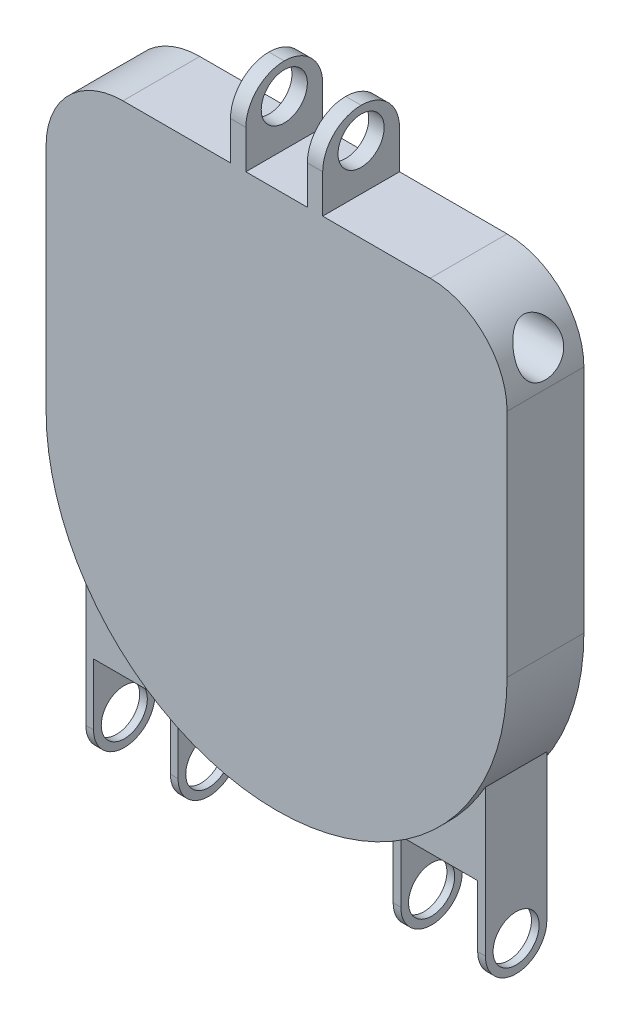
from build123d import *

# Parameters (mm, degrees)
SKETCH1_W                = 30
SKETCH1_H                = 5
BOSS_EXTRUDE1_DEPTH      = 35
FILLET1_R                = 15
FILLET3_R                = 5
SKETCH4_R                = 1.5
CUT_EXTRUDE1_DEPTH       = 35
SKETCH5_W                = 6
SKETCH5_H                = 5
SKETCH5_W_2              = 4
SKETCH5_H_2              = 3
BOSS_EXTRUDE2_DEPTH      = 5
CUT_EXTRUDE2_DEPTH       = 5
SKETCH7_R                = 1.5
CUT_EXTRUDE3_DEPTH       = 15
FILLET4_R                = 2.5
BOSS_EXTRUDE3_DEPTH      = 8
BOSS_EXTRUDE3_DEPTH_BACK = 4
SKETCH8_W                = 6
SKETCH8_H                = 4
SKETCH8_W_2              = 5
SKETCH8_H_2              = 3
SKETCH9_W                = 5
SKETCH9_H                = 4.517478875
CUT_EXTRUDE4_DEPTH       = 6
SKETCH10_R               = 1.5
CUT_EXTRUDE5_DEPTH       = 36
FILLET5_R                = 2
FILLET6_R                = 2


with BuildPart() as part:
    # Sketch1 → Boss-Extrude1 (new body)
    with BuildSketch(Plane(origin=(0, 0, 0), x_dir=(1, 0, 0), z_dir=(0, 1, 0))):
        Rectangle(SKETCH1_W, SKETCH1_H)
    extrude(amount=BOSS_EXTRUDE1_DEPTH)

    # Fillet1
    fillet1_edges = [part.edges().sort_by_distance(p)[0] for p in [
        (15, 0, 0),
        (-15, 0, 0),
    ]]
    fillet(fillet1_edges, radius=FILLET1_R - 0.0001)  # a hair under: the kernel refuses the full size

    # Fillet3
    fillet3_edges = [part.edges().sort_by_distance(p)[0] for p in [
        (15, 35, 0),
        (-15, 35, 0),
    ]]
    fillet(fillet3_edges, radius=FILLET3_R)

    # Sketch4 → Cut-Extrude1 (cut)
    with BuildSketch(Plane.ZY.offset(15)):
        with Locations((0, 32)):
            Circle(SKETCH4_R)
    extrude(amount=-CUT_EXTRUDE1_DEPTH, mode=Mode.SUBTRACT)

    # Sketch5 → Boss-Extrude2 (add)
    with BuildSketch(Plane(origin=(0, 35, 0), x_dir=(1, 0, 0), z_dir=(0, 1, 0))):
        Rectangle(SKETCH5_W, SKETCH5_H)
        Rectangle(SKETCH5_W_2, SKETCH5_H_2, mode=Mode.SUBTRACT)
    extrude(amount=BOSS_EXTRUDE2_DEPTH)

    # Sketch6 → Cut-Extrude2 (cut)
    with BuildSketch(Plane(origin=(0, 40, 0), x_dir=(1, 0, 0), z_dir=(0, 1, 0))):
        Polygon((-2, 1.5), (-2, 3.860545562), (2, 3.860545562), (2, -3.417925007), (-2, -3.417925007), align=None)
    extrude(amount=-CUT_EXTRUDE2_DEPTH, mode=Mode.SUBTRACT)

    # Sketch7 → Cut-Extrude3 (cut)
    with BuildSketch(Plane.ZY.offset(3)):
        with Locations((0, 38)):
            Circle(SKETCH7_R)
    extrude(amount=-CUT_EXTRUDE3_DEPTH, mode=Mode.SUBTRACT)

    # Fillet4
    fillet4_edges = [part.edges().sort_by_distance(p)[0] for p in [
        (-2.5, 40, 2.5),
        (-2.5, 40, -2.5),
        (2.5, 40, 2.5),
        (2.5, 40, -2.5),
    ]]
    fillet(fillet4_edges, radius=FILLET4_R - 0.0001)  # a hair under: the kernel refuses the full size

    # Sketch8 → Boss-Extrude3 (add, two sides: drawn at the far end of the back side and taken through both)
    # profile 1 of 2: a face of its own
    with BuildSketch(Plane(origin=(0, 0, 0), x_dir=(1, 0, 0), z_dir=(0, 1, 0)).offset(-BOSS_EXTRUDE3_DEPTH_BACK)):
        with Locations((-10, 0.087771821)):
            Rectangle(SKETCH8_W, SKETCH8_H)
        with Locations((-10, 0.087771821)):
            Rectangle(SKETCH8_W_2, SKETCH8_H_2, mode=Mode.SUBTRACT)
    # profile 2 of 2: a face of its own
    with BuildSketch(Plane(origin=(0, 0, 0), x_dir=(1, 0, 0), z_dir=(0, 1, 0)).offset(-BOSS_EXTRUDE3_DEPTH_BACK)):
        with Locations((10, 0.087771821)):
            Rectangle(SKETCH8_W, SKETCH8_H)
        with Locations((10, 0.087771821)):
            Rectangle(SKETCH8_W_2, SKETCH8_H_2, mode=Mode.SUBTRACT)
    extrude(amount=BOSS_EXTRUDE3_DEPTH + BOSS_EXTRUDE3_DEPTH_BACK)

    # Sketch9 → Cut-Extrude4 (cut)
    with BuildSketch(Plane.XZ.offset(4)):
        with Locations((-10, -0.111234663)):
            Rectangle(SKETCH9_W, SKETCH9_H)
        with Locations((10, -0.111234663)):
            Rectangle(SKETCH9_W, SKETCH9_H)
    extrude(amount=-CUT_EXTRUDE4_DEPTH, mode=Mode.SUBTRACT)

    # Sketch10 → Cut-Extrude5 (cut)
    with BuildSketch(Plane.ZY.offset(13)):
        with Locations(Location((-0.087771821, -2, 0), (0, 0, 180))):
            Circle(SKETCH10_R)
    extrude(amount=-CUT_EXTRUDE5_DEPTH, mode=Mode.SUBTRACT)

    # Fillet5
    fillet5_edges = [part.edges().sort_by_distance(p)[0] for p in [
        (7.25, -4, -2.087771821),
        (7.25, -4, 1.912228179),
        (12.75, -4, 1.912228179),
        (12.75, -4, -2.087771821),
    ]]
    fillet(fillet5_edges, radius=FILLET5_R - 0.0001)  # a hair under: the kernel refuses the full size

    # Fillet6
    fillet6_edges = [part.edges().sort_by_distance(p)[0] for p in [
        (-7.25, -4, 1.912228179),
        (-12.75, -4, 1.912228179),
        (-12.75, -4, -2.087771821),
        (-7.25, -4, -2.087771821),
    ]]
    fillet(fillet6_edges, radius=FILLET6_R - 0.0001)  # a hair under: the kernel refuses the full size


solid = part.part
